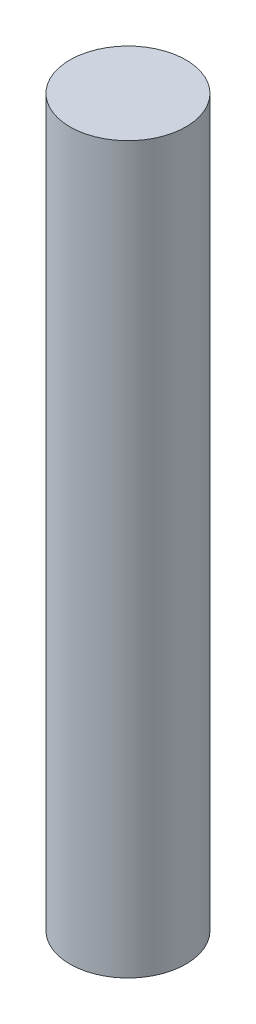
from build123d import *

# Parameters (mm, degrees)
SKETCH1_R           = 8
BOSS_EXTRUDE1_DEPTH = 100


with BuildPart() as part:
    # Sketch1 → Boss-Extrude1 (new body)
    with BuildSketch(Plane(origin=(0, 0, 0), x_dir=(1, 0, 0), z_dir=(0, 1, 0))):
        with Locations((-31.871603325, 9.541180613)):
            Circle(SKETCH1_R)
    extrude(amount=BOSS_EXTRUDE1_DEPTH)


solid = part.part
